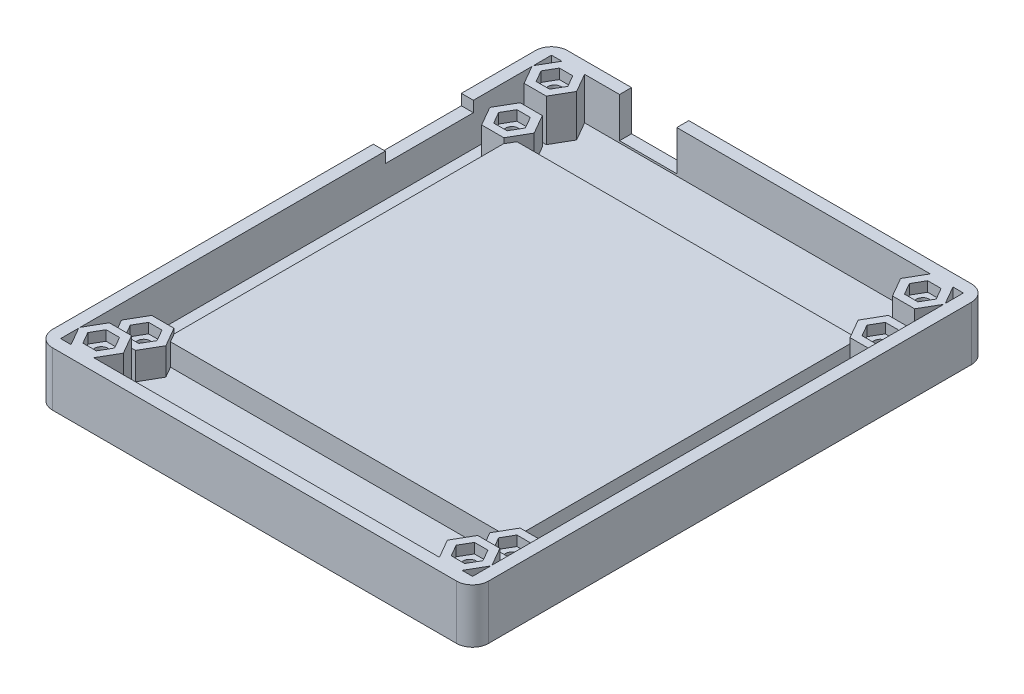
from build123d import *

# Parameters (mm, degrees)
P_IDAT_VYSUNUT_M25_DEPTH      = 3
P_IDAT_VYSUNUT_M26_DEPTH      = 10.5
P_IDAT_VYSUNUT_M26_DEPTH_BACK = 3
SKICA1_21_W                   = 108.885125168
SKICA1_21_H                   = 128.6
SKICA1_21_W_2                 = 102.885125168
SKICA1_21_H_2                 = 122.6
P_IDAT_VYSUNUT_M28_DEPTH      = 6.8
SKICA1_24_R                   = 1.6
P_IDAT_VYSUNUT_M29_DEPTH      = 4.3
LINPOLE3_COUNT                = 2
LINPOLE3_PITCH                = 92
LINPOLE3_COUNT_DIR2           = 2
LINPOLE3_PITCH_DIR2           = 92
P_IDAT_VYSUNUT_M30_DEPTH      = 10.5
SKICA1_26_R                   = 1.6
P_IDAT_VYSUNUT_M31_DEPTH      = 8
LINPOLE4_COUNT                = 2
LINPOLE4_PITCH                = 92
LINPOLE4_COUNT_DIR2           = 2
LINPOLE4_PITCH_DIR2           = 113.2
SKICA8_W                      = 86.538297386
SKICA8_H                      = 86.538297386
P_IDAT_VYSUNUT_M32_DEPTH      = 5.5
ZAOBLIT4_R                    = 4
SKICA9_W                      = 22
SKICA9_H                      = 2.7
ODEBRAT_VYSUNUT_M1_DEPTH      = 10
SKICA10_W                     = 14.3
SKICA10_H                     = 10
ODEBRAT_VYSUNUT_M2_DEPTH      = 5


with BuildPart() as part:
    # Skica1 → Přidat vysunutím25 (new body)
    with BuildSketch(Plane(origin=(0, 0, 0), x_dir=(1, 0, 0), z_dir=(0, 1, 0))):
        Polygon((51.442562584, 61.3), (-43.170983681, 61.3), (-43.228718708, 61.4), (-48.771281292, 61.4), (-48.829016319, 61.3), (-51.442562584, 61.3), (-51.442562584, 56.773205081), (-51.542562584, 56.6), (-51.442562584, 56.426794919), (-51.442562584, 46.173205081), (-51.542562584, 46), (-51.442562584, 45.826794919), (-51.442562584, -61.3), (51.442562584, -61.3), align=None)
    extrude(amount=-P_IDAT_VYSUNUT_M25_DEPTH)

    # Skica1<21> → Přidat vysunutím26 (add, two sides: drawn at the far end of the back side and taken through both)
    with BuildSketch(Plane(origin=(0, 0, 0), x_dir=(1, 0, 0), z_dir=(0, 1, 0)).offset(-P_IDAT_VYSUNUT_M26_DEPTH_BACK)):
        Rectangle(SKICA1_21_W, SKICA1_21_H)
        Rectangle(SKICA1_21_W_2, SKICA1_21_H_2, mode=Mode.SUBTRACT)
    extrude(amount=P_IDAT_VYSUNUT_M26_DEPTH + P_IDAT_VYSUNUT_M26_DEPTH_BACK)

    # Skica1<23> → Přidat vysunutím28 (add)
    with BuildSketch(Plane(origin=(0, 0, 0), x_dir=(1, 0, 0), z_dir=(0, 1, 0))):
        Polygon((-48.771281292, 41.2), (-43.228718708, 41.2), (-40.457437416, 46), (-43.228718708, 50.8), (-48.771281292, 50.8), (-51.542562584, 46), align=None)
        Polygon((-44.325684219, 43.1), (-47.674315781, 43.1), (-49.348631561, 46), (-47.674315781, 48.9), (-44.325684219, 48.9), (-42.651368439, 46), align=None, mode=Mode.SUBTRACT)
    p_idat_vysunut_m28 = extrude(amount=P_IDAT_VYSUNUT_M28_DEPTH)

    # Skica1<24> → Přidat vysunutím29 (add)
    with BuildSketch(Plane(origin=(0, 0, 0), x_dir=(1, 0, 0), z_dir=(0, 1, 0))):
        Polygon((-49.348631561, 46), (-47.674315781, 43.1), (-44.325684219, 43.1), (-42.651368439, 46), (-44.325684219, 48.9), (-47.674315781, 48.9), align=None)
        with Locations((-46, 46)):
            Circle(SKICA1_24_R, mode=Mode.SUBTRACT)
    p_idat_vysunut_m29 = extrude(amount=P_IDAT_VYSUNUT_M29_DEPTH)

    # LinPole3: Přidat vysunutím28, P_idat vysunut_m29 2 × 2
    with Locations(*[(i * LINPOLE3_PITCH, 0, j * LINPOLE3_PITCH_DIR2) for i in range(LINPOLE3_COUNT) for j in range(LINPOLE3_COUNT_DIR2) if (i, j) != (0, 0)]):
        add(p_idat_vysunut_m28)
        add(p_idat_vysunut_m29)

    # Skica1<25> → Přidat vysunutím30 (add)
    with BuildSketch(Plane(origin=(0, 0, 0), x_dir=(1, 0, 0), z_dir=(0, 1, 0))):
        Polygon((-51.542562584, 56.6), (-48.771281292, 51.8), (-43.228718708, 51.8), (-40.457437416, 56.6), (-43.228718708, 61.4), (-48.771281292, 61.4), align=None)
        Polygon((-44.325684219, 59.5), (-42.651368439, 56.6), (-44.325684219, 53.7), (-47.674315781, 53.7), (-49.348631561, 56.6), (-47.674315781, 59.5), align=None, mode=Mode.SUBTRACT)
    p_idat_vysunut_m30 = extrude(amount=P_IDAT_VYSUNUT_M30_DEPTH)

    # Skica1<26> → Přidat vysunutím31 (add)
    with BuildSketch(Plane(origin=(0, 0, 0), x_dir=(1, 0, 0), z_dir=(0, 1, 0))):
        Polygon((-44.325684219, 53.7), (-42.651368439, 56.6), (-44.325684219, 59.5), (-47.674315781, 59.5), (-49.348631561, 56.6), (-47.674315781, 53.7), align=None)
        with Locations((-46, 56.6)):
            Circle(SKICA1_26_R, mode=Mode.SUBTRACT)
    p_idat_vysunut_m31 = extrude(amount=P_IDAT_VYSUNUT_M31_DEPTH)

    # LinPole4: Přidat vysunutím30, P_idat vysunut_m31 2 × 2
    with Locations(*[(i * LINPOLE4_PITCH, 0, j * LINPOLE4_PITCH_DIR2) for i in range(LINPOLE4_COUNT) for j in range(LINPOLE4_COUNT_DIR2) if (i, j) != (0, 0)]):
        add(p_idat_vysunut_m30)
        add(p_idat_vysunut_m31)

    # Skica8 → Přidat vysunutím32 (add)
    with BuildSketch(Plane(origin=(0, 0, 0), x_dir=(1, 0, 0), z_dir=(0, 1, 0))):
        Rectangle(SKICA8_W, SKICA8_H)
    extrude(amount=P_IDAT_VYSUNUT_M32_DEPTH)

    # Zaoblit4
    zaoblit4_edges = [part.edges().sort_by_distance(p)[0] for p in [
        (-54.442562584, 3.75, 64.3),
        (54.442562584, 3.75, 64.3),
        (54.442562584, 3.75, -64.3),
        (-54.442562584, 3.75, -64.3),
    ]]
    fillet(zaoblit4_edges, radius=ZAOBLIT4_R)

    # Skica9 → Odebrat vysunutím1 (cut)
    with BuildSketch(Plane.ZY.offset(54.442562584)):
        with Locations((-30.8, 9.15)):
            Rectangle(SKICA9_W, SKICA9_H)
    extrude(amount=-ODEBRAT_VYSUNUT_M1_DEPTH, mode=Mode.SUBTRACT)

    # Skica10 → Odebrat vysunutím2 (cut)
    with BuildSketch(Plane(origin=(0, 0, -64.3), x_dir=(-1, 0, 0), z_dir=(0, 0, -1))):
        with Locations((27.292562584, 5.5)):
            Rectangle(SKICA10_W, SKICA10_H)
    extrude(amount=-ODEBRAT_VYSUNUT_M2_DEPTH, mode=Mode.SUBTRACT)


solid = part.part
